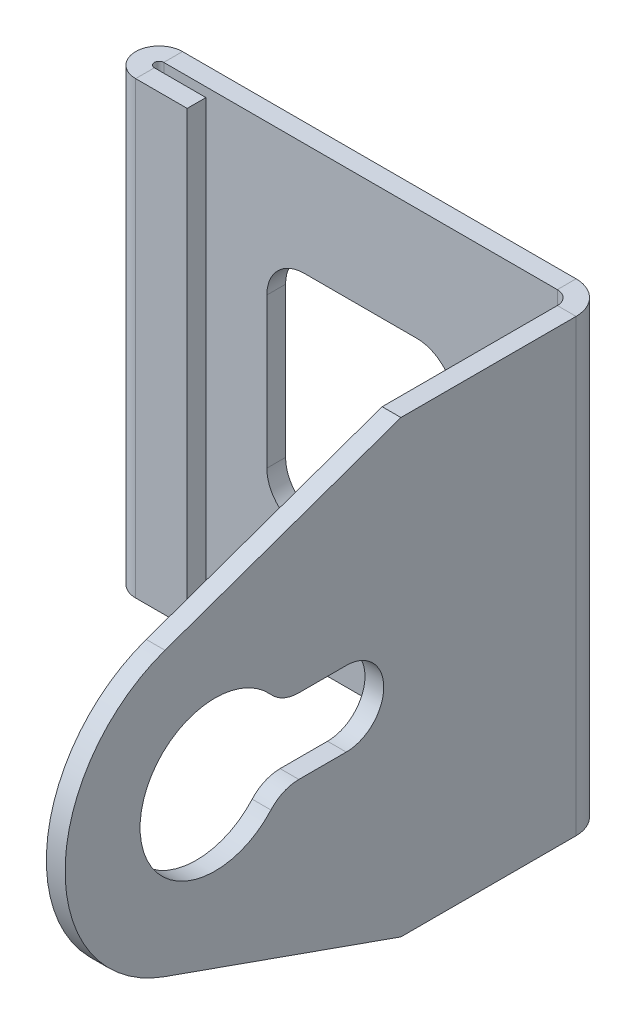
from build123d import *

# Parameters (mm, degrees)
SKETCH1_W               = 21
SKETCH1_H               = 24
BASE_FLANGE1_DEPTH      = 1
EDGE_FLANGE1_DEPTH      = 24
EDGE_FLANGE1_START      = 1
EDGE_FLANGE1_FLAT_DEPTH = 1
HEM1_START              = -12
HEM1_DEPTH              = 24


# Read off the part's stored shape, not the designer's step: Hem1
# Sheet-metal steps are written as plain solids
with BuildPart() as part:
    # Sketch1 → Base-Flange1 (new body)
    with BuildSketch(Plane.XY):
        Rectangle(SKETCH1_W, SKETCH1_H)
        with BuildLine():
            Line((-3, 6), (3, 6))
            ThreePointArc((3, 6), (4.414213562, 5.414213562), (5, 4))
            Line((5, 4), (5, -4))
            ThreePointArc((5, -4), (4.414213562, -5.414213562), (3, -6))
            Line((3, -6), (-3, -6))
            ThreePointArc((-3, -6), (-4.414213562, -5.414213562), (-5, -4))
            Line((-5, -4), (-5, 4))
            ThreePointArc((-5, 4), (-4.414213562, 5.414213562), (-3, 6))
        make_face(mode=Mode.SUBTRACT)
    extrude(amount=-BASE_FLANGE1_DEPTH)

    # Edge-Flange1 bend section (across the edge) → Edge-Flange1 (add)
    with BuildSketch(Plane(origin=(11.2366, -12, 0), x_dir=(-1, 0, 0), z_dir=(0, 1, 0))):
        with BuildLine():
            Line((-1, 0.7366), (0, 0.7366))
            ThreePointArc((0, 0.7366), (0.215745145, 0.215745145), (0.7366, 0))
            Line((0.7366, 0), (0.7366, -1))
            ThreePointArc((0.7366, -1), (-0.491361636, -0.491361636), (-1, 0.7366))
        make_face()
    extrude(amount=EDGE_FLANGE1_DEPTH)

    # Edge-Flange1 profile (on flange) → Edge-Flange1 flat (add)
    with BuildSketch(Plane.YZ.offset(11.2366).offset(EDGE_FLANGE1_START)):
        with BuildLine():
            ThreePointArc((7.540895956, 22.671121147), (0, 28), (-7.540895956, 22.671121147))
            Line((-7.540895956, 22.671121147), (-12, 10.082534632))
            Line((-12, 10.082534632), (-12, 0.7366))
            Line((-12, 0.7366), (12, 0.7366))
            Line((12, 0.7366), (12, 10.082534632))
            Line((12, 10.082534632), (7.540895956, 22.671121147))
        make_face()
        with BuildLine():
            ThreePointArc((2, 13), (0, 11), (-2, 13))
            Line((-2, 13), (-2, 15.527864045))
            ThreePointArc((-2, 15.527864045), (-2.174258142, 16.344360626), (-2.666666667, 17.01857603))
            ThreePointArc((-2.666666667, 17.01857603), (0, 24), (2.666666667, 17.01857603))
            ThreePointArc((2.666666667, 17.01857603), (2.174258142, 16.344360626), (2, 15.527864045))
            Line((2, 15.527864045), (2, 13))
        make_face(mode=Mode.SUBTRACT)
    extrude(amount=-EDGE_FLANGE1_FLAT_DEPTH)

    # Hem1 outline → Hem1 (add)
    with BuildSketch(Plane(origin=(0, 0, 0), x_dir=(1, 0, 0), z_dir=(0, 1, 0)).offset(HEM1_START)):
        with BuildLine():
            Line((-7.75, -1.5), (-7.75, -0.5))
            Line((-7.75, -0.5), (-10.5, -0.5))
            ThreePointArc((-10.5, -0.5), (-10.75, -0.25), (-10.5, 0))
            Line((-10.5, 0), (-10.5, 1))
            ThreePointArc((-10.5, 1), (-11.75, -0.25), (-10.5, -1.5))
            Line((-10.5, -1.5), (-7.75, -1.5))
        make_face()
    extrude(amount=HEM1_DEPTH)


solid = part.part
